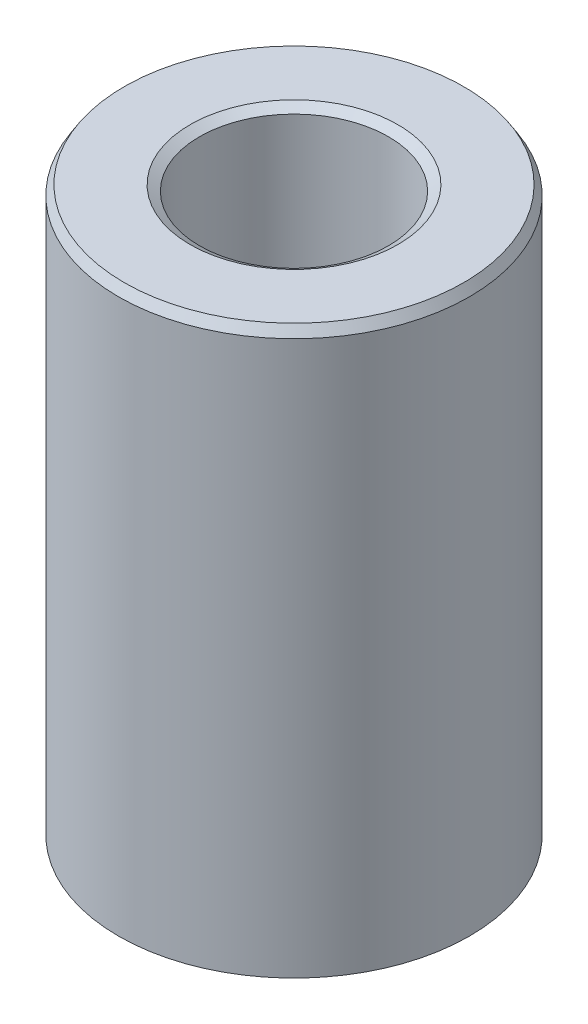
from build123d import *
from OCP.BRepFilletAPI import BRepFilletAPI_MakeChamfer

# Parameters (mm, degrees)
SKETCH1_R           = 42.5
BOSS_EXTRUDE1_DEPTH = 137.745571453
SKETCH2_R           = 22.888005839
CUT_EXTRUDE1_DEPTH  = 151.287532599
CHAMFER1_SIZE       = 2.27448422
CHAMFER1_SIZE2      = 1.388655238


with BuildPart() as part:
    # Sketch1 → Boss-Extrude1 (new body)
    with BuildSketch(Plane(origin=(0, 0, 0), x_dir=(1, 0, 0), z_dir=(0, 1, 0))):
        Circle(SKETCH1_R)
    extrude(amount=BOSS_EXTRUDE1_DEPTH)

    # Sketch2 → Cut-Extrude1 (cut, through all)
    with BuildSketch(Plane(origin=(0, 0, 0), x_dir=(1, 0, 0), z_dir=(0, 1, 0))):
        Circle(SKETCH2_R)
    extrude(amount=CUT_EXTRUDE1_DEPTH, mode=Mode.SUBTRACT)

    # Chamfer1: one chamfer whose edges measure the first distance from different faces: ONE call of the kernel's chamfer builder (chamfer() names one face for all edges)
    chamfer1_edges_1 = [part.edges().sort_by_distance(p)[0] for p in [
        (-22.888005839, 137.745571453, 0),
    ]]
    chamfer1_side_1 = [part.faces().sort_by_distance(p)[0] for p in [
        (-41.297918472, 137.745571453, 0),
    ]]
    chamfer1_edges_2 = [part.edges().sort_by_distance(p)[0] for p in [
        (-22.888005839, 0, 0),
    ]]
    chamfer1_side_2 = [part.faces().sort_by_distance(p)[0] for p in [
        (-22.888005839, 68.872785726, 0),
    ]]
    chamfer1_edges_3 = [part.edges().sort_by_distance(p)[0] for p in [
        (-42.5, 0, 0),
    ]]
    chamfer1_side_3 = [part.faces().sort_by_distance(p)[0] for p in [
        (-41.297918472, 0, 0),
    ]]
    chamfer1_edges_4 = [part.edges().sort_by_distance(p)[0] for p in [
        (-42.5, 137.745571453, 0),
    ]]
    chamfer1_side_4 = [part.faces().sort_by_distance(p)[0] for p in [
        (-42.5, 68.872785726, 0),
    ]]
    chamfer1 = BRepFilletAPI_MakeChamfer(part.part.solid().wrapped)
    for e in chamfer1_edges_1:
        chamfer1.Add(CHAMFER1_SIZE, CHAMFER1_SIZE2, e.wrapped, chamfer1_side_1[0].wrapped)  # the first distance lies on this face
    for e in chamfer1_edges_2:
        chamfer1.Add(CHAMFER1_SIZE, CHAMFER1_SIZE2, e.wrapped, chamfer1_side_2[0].wrapped)  # the first distance lies on this face
    for e in chamfer1_edges_3:
        chamfer1.Add(CHAMFER1_SIZE, CHAMFER1_SIZE2, e.wrapped, chamfer1_side_3[0].wrapped)  # the first distance lies on this face
    for e in chamfer1_edges_4:
        chamfer1.Add(CHAMFER1_SIZE, CHAMFER1_SIZE2, e.wrapped, chamfer1_side_4[0].wrapped)  # the first distance lies on this face
    add(Compound.cast(chamfer1.Shape()), mode=Mode.REPLACE)


solid = part.part
